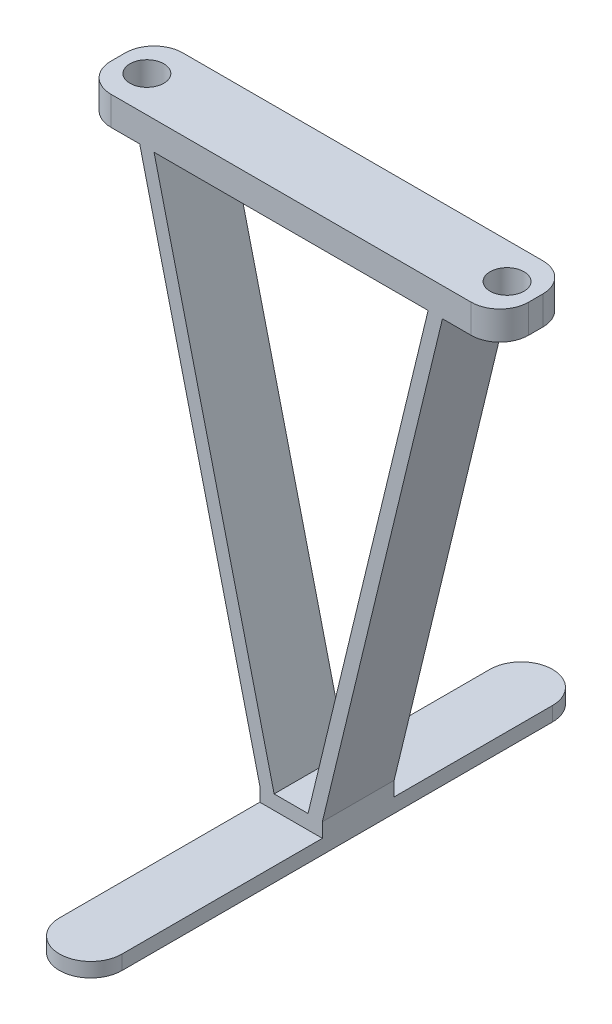
from build123d import *

# Parameters (mm, degrees)
SKETCH1_R           = 3
BOSS_EXTRUDE1_DEPTH = 5.08
BOSS_EXTRUDE2_DEPTH = 12.7
BOSS_EXTRUDE3_DEPTH = 2.54


with BuildPart() as part:
    # Sketch1 → Boss-Extrude1 (new body)
    with BuildSketch(Plane(origin=(0, 0, 0), x_dir=(1, 0, 0), z_dir=(0, 1, 0))):
        with BuildLine():
            Line((-24.747623202, 6.35), (-30.399794039, 6.35))
            ThreePointArc((-30.399794039, 6.35), (-33.991896487, 4.862102448), (-35.479794039, 1.27))
            Line((-35.479794039, 1.27), (-35.479794039, -1.27))
            ThreePointArc((-35.479794039, -1.27), (-33.991896487, -4.862102448), (-30.399794039, -6.35))
            Line((-30.399794039, -6.35), (-24.747623202, -6.35))
            Line((-24.747623202, -6.35), (27.702035125, -6.35))
            Line((27.702035125, -6.35), (33.354205961, -6.35))
            ThreePointArc((33.354205961, -6.35), (36.94630841, -4.862102448), (38.434205961, -1.27))
            Line((38.434205961, -1.27), (38.434205961, 1.27))
            ThreePointArc((38.434205961, 1.27), (36.94630841, 4.862102448), (33.354205961, 6.35))
            Line((33.354205961, 6.35), (27.702035125, 6.35))
            Line((27.702035125, 6.35), (-24.747623202, 6.35))
        make_face()
        with Locations((-30.399794039, 0)):
            Circle(SKETCH1_R, mode=Mode.SUBTRACT)
        with Locations((33.354205961, 0)):
            Circle(SKETCH1_R, mode=Mode.SUBTRACT)
    extrude(amount=BOSS_EXTRUDE1_DEPTH)

    # Sketch3 → Boss-Extrude2 (add)
    with BuildSketch(Plane.XY.offset(6.35)):
        Polygon((-25.319794039, 0), (-4.062794039, -87.74317324), (-4.062794039, -90.28317324), (7.017205961, -90.28317324), (7.017205961, -87.74317324), (28.274205961, 0), (25.734205961, 0), (4.477205961, -87.74317324), (-1.522794039, -87.74317324), (-22.779794039, 0), align=None)
    extrude(amount=-BOSS_EXTRUDE2_DEPTH)

    # Sketch4 → Boss-Extrude3 (add)
    with BuildSketch(Plane.XZ.offset(90.28317324)):
        with BuildLine():
            Line((-4.062794039, 41.80872522), (-4.062794039, -34.39127478))
            ThreePointArc((-4.062794039, -34.39127478), (1.477205961, -39.93127478), (7.017205961, -34.39127478))
            Line((7.017205961, -34.39127478), (7.017205961, 41.80872522))
            ThreePointArc((7.017205961, 41.80872522), (1.477205961, 47.34872522), (-4.062794039, 41.80872522))
        make_face()
    extrude(amount=BOSS_EXTRUDE3_DEPTH)


solid = part.part
